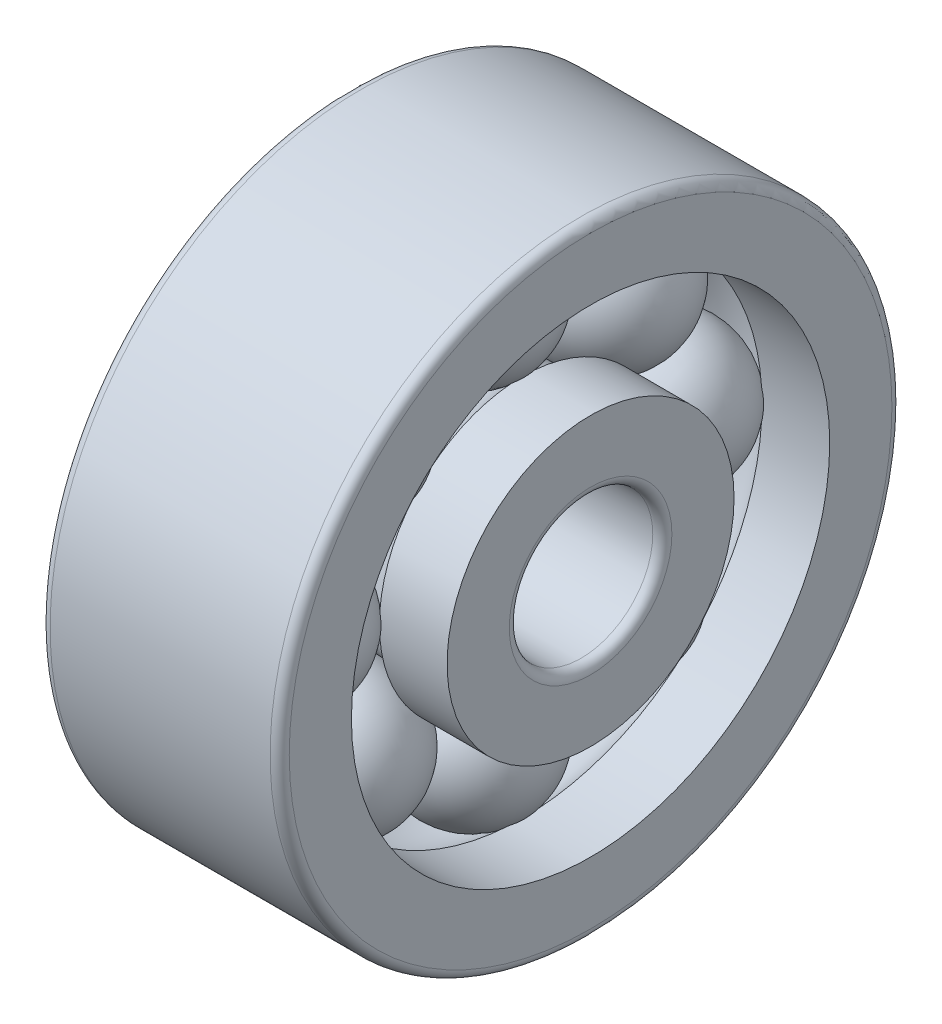
from build123d import *

# Parameters (mm, degrees)
CAGSPISKE_W         = 0.3
CAGSPISKE_H         = 0.5
CAGESPINE_ANGLE     = 0.001
BALLSDETAILED_COUNT = 8
BALLSDETAILED_ANGLE = 315


with BuildPart() as part:
    # CagSpiSke → CageSpine (revolve)
    with BuildSketch(Plane.XY):
        with Locations((0, 4)):
            Rectangle(CAGSPISKE_W, CAGSPISKE_H)
    revolve(axis=Axis((-20.6375, 0, 0), (-1, 0, 0)), revolution_arc=CAGESPINE_ANGLE)

    # BalDetSke → BallDetailed (revolve)
    with BuildSketch(Plane.XY):
        with BuildLine():
            Line((-1.5, 4), (1.5, 4))
            ThreePointArc((1.5, 4), (0, 2.5), (-1.5, 4))
        make_face()
    balldetailed = revolve(axis=Axis((-1.905, 4, 0), (1, 0, 0)))

    # InnRacSke → InnerRace (revolve)
    with BuildSketch(Plane.XY):
        with BuildLine():
            Line((-1.084262422, 3), (-2.5, 3))
            Line((-2.5, 3), (-2.5, 1.7))
            ThreePointArc((-2.5, 1.7), (-2.441421356, 1.558578644), (-2.3, 1.5))
            Line((-2.3, 1.5), (2.3, 1.5))
            ThreePointArc((2.3, 1.5), (2.441421356, 1.558578644), (2.5, 1.7))
            Line((2.5, 1.7), (2.5, 3))
            Line((2.5, 3), (1.084262422, 3))
            ThreePointArc((1.084262422, 3), (0, 2.525), (-1.084262422, 3))
        make_face()
    revolve(axis=Axis((-20.6375, 0, 0), (1, 0, 0)))

    # OutRacSke → OuterRace (revolve)
    with BuildSketch(Plane.XY):
        with BuildLine():
            Line((-1.084262422, 5), (-2.5, 5))
            Line((-2.5, 5), (-2.5, 6.3))
            ThreePointArc((-2.5, 6.3), (-2.441421356, 6.441421356), (-2.3, 6.5))
            Line((-2.3, 6.5), (2.3, 6.5))
            ThreePointArc((2.3, 6.5), (2.441421356, 6.441421356), (2.5, 6.3))
            Line((2.5, 6.3), (2.5, 5))
            Line((2.5, 5), (1.084262422, 5))
            ThreePointArc((1.084262422, 5), (0, 5.475), (-1.084262422, 5))
        make_face()
    revolve(axis=Axis((-20.6375, 0, 0), (1, 0, 0)))

    # BallsDetailed: BallDetailed ×8 about axis
    ballsdetailed_axis = Axis((-50, 0, 0), (1, 0, 0))
    for i in range(1, BALLSDETAILED_COUNT):
        add(balldetailed.rotate(ballsdetailed_axis, i * BALLSDETAILED_ANGLE / (BALLSDETAILED_COUNT - 1)))


solid = part.part
